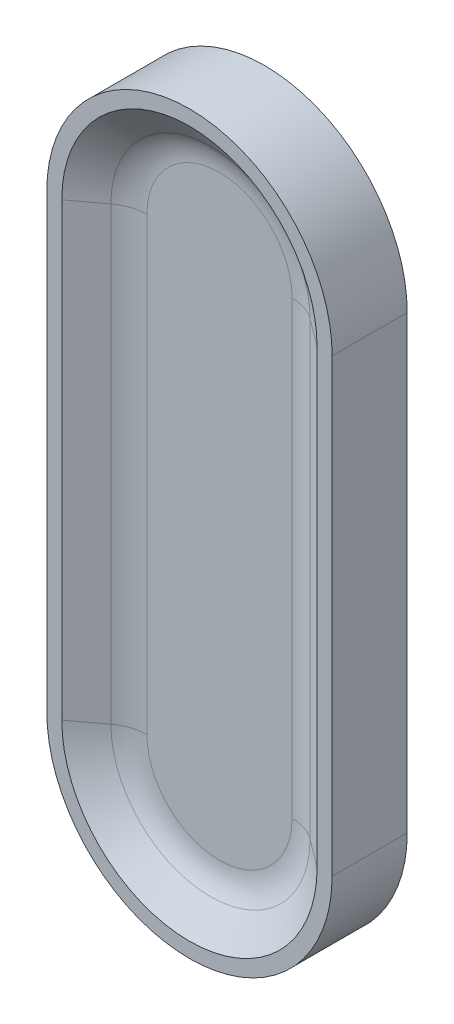
from build123d import *

# Parameters (mm, degrees)
Y_KSEKLIK_EKSTR_ZYON1_DEPTH = 5
KES_EKSTR_ZYON1_DEPTH       = 2
PAH1_SIZE                   = 4
PAH1_SIZE_2                 = 3
RADYUS1_R                   = 3


with BuildPart() as part:
    # Çizim1 → Yükseklik-Ekstrüzyon1 (new body)
    with BuildSketch(Plane.XY):
        with BuildLine():
            Line((-9.5, -15), (-9.5, 15))
            ThreePointArc((-9.5, 15), (0, 24.5), (9.5, 15))
            Line((9.5, 15), (9.5, -15))
            ThreePointArc((9.5, -15), (0, -24.5), (-9.5, -15))
        make_face()
    extrude(amount=Y_KSEKLIK_EKSTR_ZYON1_DEPTH)

    # Çizim2 → Kes-Ekstrüzyon1 (cut)
    with BuildSketch(Plane.XY.offset(5)):
        with BuildLine():
            Line((-4.5, 15), (-4.5, -15))
            ThreePointArc((-4.5, -15), (0, -19.5), (4.5, -15))
            Line((4.5, -15), (4.5, 15))
            ThreePointArc((4.5, 15), (0, 19.5), (-4.5, 15))
        make_face()
    extrude(amount=-KES_EKSTR_ZYON1_DEPTH, mode=Mode.SUBTRACT)

    # Pah1
    # the kernel refuses this chamfer: 4, 3 mm, written as the material it takes off along each edge
    with BuildSketch(Plane(origin=(0, -15, 5), x_dir=(-1, 0, 0), z_dir=(0, 1, 0))) as pah1_piece_1_section:
        Polygon((4.5 + PAH1_SIZE, 0), (4.5, -PAH1_SIZE_2), (4.5, 0), align=None)
    pah1_piece_1 = revolve(axis=Axis((0, -15, 5), (0, 0, 1)), revolution_arc=180, mode=Mode.PRIVATE)
    pah1_piece_1 = split(pah1_piece_1, bisect_by=Plane(origin=(0, -22.201904041, 3), z_dir=(0, 0, 1)), keep=Keep.TOP, mode=Mode.PRIVATE)
    add(pah1_piece_1, mode=Mode.SUBTRACT)
    with BuildSketch(Plane(origin=(4.5, -15, 5), x_dir=(0.9997296931968459, 0, 0.023249527748763873), z_dir=(0, 1, 0))) as pah1_piece_2_section:
        Polygon((PAH1_SIZE * 0.999729693197, PAH1_SIZE * 0.0232495277488), (-PAH1_SIZE_2 * 0.0232495277488, PAH1_SIZE_2 * 0.999729693197), (0, 0), align=None)
    pah1_piece_2 = extrude(amount=30, mode=Mode.PRIVATE)
    pah1_piece_2 = split(pah1_piece_2, bisect_by=Plane(origin=(5.968375105, 0, 3), z_dir=(0, 0, 1)), keep=Keep.TOP, mode=Mode.PRIVATE)
    add(pah1_piece_2, mode=Mode.SUBTRACT)
    with BuildSketch(Plane(origin=(-4.5, 15, 5), x_dir=(-0.9997296931968459, 0, 0.023249527748763883), z_dir=(0, -1, 0))) as pah1_piece_3_section:
        Polygon((PAH1_SIZE * 0.999729693197, PAH1_SIZE * 0.0232495277488), (-PAH1_SIZE_2 * 0.0232495277488, PAH1_SIZE_2 * 0.999729693197), (0, 0), align=None)
    pah1_piece_3 = extrude(amount=30, mode=Mode.PRIVATE)
    pah1_piece_3 = split(pah1_piece_3, bisect_by=Plane(origin=(-5.968375105, 0, 3), z_dir=(0, 0, 1)), keep=Keep.TOP, mode=Mode.PRIVATE)
    add(pah1_piece_3, mode=Mode.SUBTRACT)
    with BuildSketch(Plane(origin=(0, 15, 5), x_dir=(1, 0, 0), z_dir=(0, -1, 0))) as pah1_piece_4_section:
        Polygon((4.5 + PAH1_SIZE, 0), (4.5, -PAH1_SIZE_2), (4.5, 0), align=None)
    pah1_piece_4 = revolve(axis=Axis((0, 15, 5), (0, 0, 1)), revolution_arc=180, mode=Mode.PRIVATE)
    pah1_piece_4 = split(pah1_piece_4, bisect_by=Plane(origin=(0, 22.201904042, 3), z_dir=(0, 0, 1)), keep=Keep.TOP, mode=Mode.PRIVATE)
    add(pah1_piece_4, mode=Mode.SUBTRACT)

    # Radyus1
    radyus1_edges = [part.edges().sort_by_distance(p)[0] for p in [
        (0, -20.833333333, 3),
        (5.833333333, 0, 3),
        (-5.833333333, 0, 3),
        (0, 20.833333333, 3),
    ]]
    fillet(radyus1_edges, radius=RADYUS1_R)


solid = part.part
